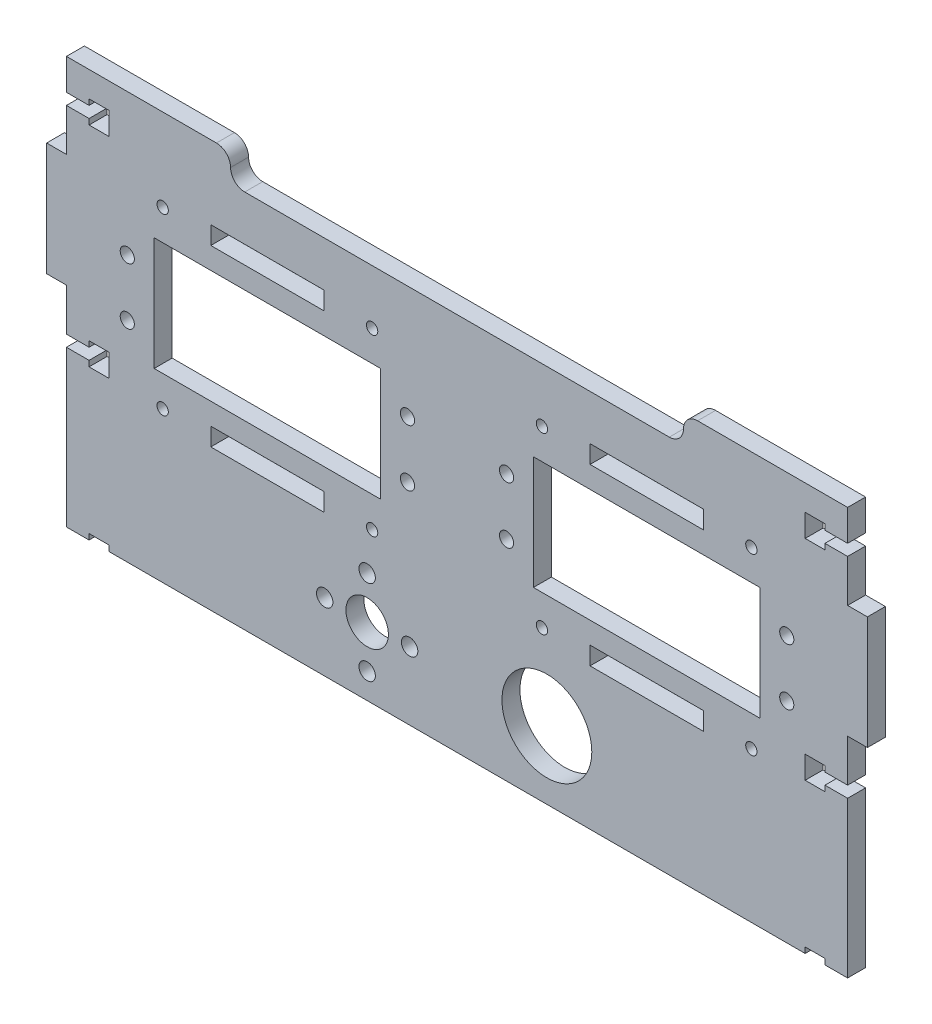
from build123d import *

# Parameters (mm, degrees)
BOSS_EXTRUDE1_DEPTH     = 3.175
CUT_EXTRUDE1_DEPTH      = 78.429520372
MIRROR2_COPY_1_DEPTH    = 78.429520372
SKETCH4_W               = 138
SKETCH4_H               = 20
BOSS_EXTRUDE3_DEPTH     = 3.175
CUT_EXTRUDE2_DEPTH      = 87.459994362
CUT_EXTRUDE2_DEPTH_BACK = 87.459994362
SKETCH5_W               = 80
SKETCH5_H               = 5
FILLET1_R               = 2.5
SKETCH6_W               = 3.5
SKETCH6_H               = 1
CUT_EXTRUDE3_DEPTH      = 87.459994362
SKETCH10_W              = 40
SKETCH10_H              = 20
CUT_EXTRUDE4_DEPTH      = 87.459994362
SKETCH11_R              = 1
SKETCH11_W              = 20
SKETCH11_H              = 3.18
CUT_EXTRUDE5_DEPTH      = 87.459994362
SKETCH12_R              = 1.25
CUT_EXTRUDE6_DEPTH      = 87.459994362
MIRROR5_COPY_1_SKETCH_R = 1
MIRROR5_COPY_1_SKETCH_W = 20
MIRROR5_COPY_1_SKETCH_H = 3.18
MIRROR5_COPY_1_DEPTH    = 87.459994362
MIRROR5_COPY_2_SKETCH_R = 1.25
MIRROR5_COPY_2_DEPTH    = 87.459994362
SKETCH13_R              = 3.75
SKETCH13_R_2            = 7.9375
CUT_EXTRUDE7_DEPTH      = 87.459994362
SKETCH14_R              = 1.45
CUT_EXTRUDE8_DEPTH      = 87.459994362


with BuildPart() as part:
    # Sketch1 → Boss-Extrude1 (new body)
    with BuildSketch(Plane.XY):
        Polygon((-69, -10), (-69, -27), (69, -27), (69, -10), (72.5, -10), (72.5, 10), (69, 10), (69, 25), (-69, 25), (-69, 10), (-72.5, 10), (-72.5, -10), align=None)
    extrude(amount=-BOSS_EXTRUDE1_DEPTH)

    # Sketch2 → Cut-Extrude1 (cut, symmetric)
    with BuildSketch(Plane.XY):
        Polygon((-69, 19.5), (-65, 19.5), (-65, 20.5), (-61.5, 20.5), (-61.5, 16.5), (-65, 16.5), (-65, 17.5), (-69, 17.5), align=None)
    cut_extrude1 = extrude(amount=CUT_EXTRUDE1_DEPTH, both=True, mode=Mode.SUBTRACT)

    # Mirror1: Cut-Extrude1 across plane
    add(cut_extrude1.mirror(Plane.ZY), mode=Mode.SUBTRACT)

    # Mirror2: Cut-Extrude1 across plane
    add(cut_extrude1.mirror(Plane.ZX), mode=Mode.SUBTRACT)

    # Mirror2 copy 1 sketch → Mirror2 copy 1 (cut, symmetric)
    with BuildSketch(Plane(origin=(0, 0, 0), x_dir=(-1, 0, 0), z_dir=(0, 0, 1))):
        Polygon((-69, 19.5), (-65, 19.5), (-65, 20.5), (-61.5, 20.5), (-61.5, 16.5), (-65, 16.5), (-65, 17.5), (-69, 17.5), align=None)
    extrude(amount=MIRROR2_COPY_1_DEPTH, both=True, mode=Mode.SUBTRACT)

    # Sketch4 → Boss-Extrude3 (add)
    with BuildSketch(Plane.XY):
        with Locations((0, -37)):
            Rectangle(SKETCH4_W, SKETCH4_H)
    extrude(amount=-BOSS_EXTRUDE3_DEPTH)

    # Sketch5 → Cut-Extrude2 (cut, two sides: drawn at the far end of the back side and taken through both)
    with BuildSketch(Plane.XY.offset(-CUT_EXTRUDE2_DEPTH_BACK)):
        with Locations((0, 22.5)):
            Rectangle(SKETCH5_W, SKETCH5_H)
    extrude(amount=CUT_EXTRUDE2_DEPTH + CUT_EXTRUDE2_DEPTH_BACK, mode=Mode.SUBTRACT)

    # Fillet1
    fillet1_edges = [part.edges().sort_by_distance(p)[0] for p in [
        (40, 20, -1.5875),
        (-40, 20, -1.5875),
    ]]
    fillet(fillet1_edges, radius=FILLET1_R)
    fillet1_2_edges = [part.edges().sort_by_distance(p)[0] for p in [
        (40, 25, -1.5875),
        (-40, 25, -1.5875),
    ]]
    fillet(fillet1_2_edges, radius=FILLET1_R - 0.0001)  # a hair under: the kernel refuses the full size

    # Sketch6 → Cut-Extrude3 (cut, symmetric)
    with BuildSketch(Plane.XY):
        with Locations((63.25, -46.5)):
            Rectangle(SKETCH6_W, SKETCH6_H)
    cut_extrude3 = extrude(amount=CUT_EXTRUDE3_DEPTH, both=True, mode=Mode.SUBTRACT)

    # Mirror3: Cut-Extrude3 across plane
    add(cut_extrude3.mirror(Plane.ZY), mode=Mode.SUBTRACT)

    # Sketch10 → Cut-Extrude4 (cut, through all)
    with BuildSketch(Plane(origin=(0, 0, -3.175), x_dir=(-1, 0, 0), z_dir=(0, 0, -1))):
        with Locations((33.5, -5)):
            Rectangle(SKETCH10_W, SKETCH10_H)
    cut_extrude4 = extrude(amount=-CUT_EXTRUDE4_DEPTH, mode=Mode.SUBTRACT)

    # Sketch11 → Cut-Extrude5 (cut, through all)
    with BuildSketch(Plane(origin=(0, 0, -3.175), x_dir=(-1, 0, 0), z_dir=(0, 0, -1))):
        with Locations((15, -20.41)):
            Circle(SKETCH11_R)
        with Locations((52, -20.41)):
            Circle(SKETCH11_R)
        with Locations((33.5, -20.41)):
            Rectangle(SKETCH11_W, SKETCH11_H)
    cut_extrude5 = extrude(amount=-CUT_EXTRUDE5_DEPTH, mode=Mode.SUBTRACT)

    # Sketch12 → Cut-Extrude6 (cut, through all)
    with BuildSketch(Plane(origin=(0, 0, -3.175), x_dir=(-1, 0, 0), z_dir=(0, 0, -1))):
        with Locations((8.75, -10)):
            Circle(SKETCH12_R)
        with Locations((58.25, -10)):
            Circle(SKETCH12_R)
    cut_extrude6 = extrude(amount=-CUT_EXTRUDE6_DEPTH, mode=Mode.SUBTRACT)

    # Mirror4: Cut-Extrude5, Cut-Extrude6 across plane
    add(cut_extrude5.mirror(Plane.ZX.offset(-5)), mode=Mode.SUBTRACT)
    add(cut_extrude6.mirror(Plane.ZX.offset(-5)), mode=Mode.SUBTRACT)

    # Mirror5: Cut-Extrude4, Cut-Extrude5, Cut-Extrude6 across plane
    add(cut_extrude4.mirror(Plane.ZY), mode=Mode.SUBTRACT)
    add(cut_extrude5.mirror(Plane.ZY), mode=Mode.SUBTRACT)
    add(cut_extrude6.mirror(Plane.ZY), mode=Mode.SUBTRACT)

    # Mirror5 copy 1 sketch → Mirror5 copy 1 (cut, through all)
    with BuildSketch(Plane(origin=(0, -10, -3.175), x_dir=(1, 0, 0), z_dir=(0, 0, -1))):
        with Locations((15, -20.41)):
            Circle(MIRROR5_COPY_1_SKETCH_R)
        with Locations((52, -20.41)):
            Circle(MIRROR5_COPY_1_SKETCH_R)
        with Locations((33.5, -20.41)):
            Rectangle(MIRROR5_COPY_1_SKETCH_W, MIRROR5_COPY_1_SKETCH_H)
    extrude(amount=-MIRROR5_COPY_1_DEPTH, mode=Mode.SUBTRACT)

    # Mirror5 copy 2 sketch → Mirror5 copy 2 (cut, through all)
    with BuildSketch(Plane(origin=(0, -10, -3.175), x_dir=(1, 0, 0), z_dir=(0, 0, -1))):
        with Locations((8.75, -10)):
            Circle(MIRROR5_COPY_2_SKETCH_R)
        with Locations((58.25, -10)):
            Circle(MIRROR5_COPY_2_SKETCH_R)
    extrude(amount=-MIRROR5_COPY_2_DEPTH, mode=Mode.SUBTRACT)

    # Sketch13 → Cut-Extrude7 (cut, through all)
    with BuildSketch(Plane.XY):
        with Locations((-15.875, -35)):
            Circle(SKETCH13_R)
        with Locations((15.875, -35)):
            Circle(SKETCH13_R_2)
    extrude(amount=-CUT_EXTRUDE7_DEPTH, mode=Mode.SUBTRACT)

    # Sketch14 → Cut-Extrude8 (cut, through all)
    with BuildSketch(Plane.XY):
        with Locations((-23.375, -35)):
            Circle(SKETCH14_R)
        with Locations((-15.875, -27.5)):
            Circle(SKETCH14_R)
        with Locations((-8.375, -35)):
            Circle(SKETCH14_R)
        with Locations((-15.875, -42.5)):
            Circle(SKETCH14_R)
    extrude(amount=-CUT_EXTRUDE8_DEPTH, mode=Mode.SUBTRACT)


solid = part.part
